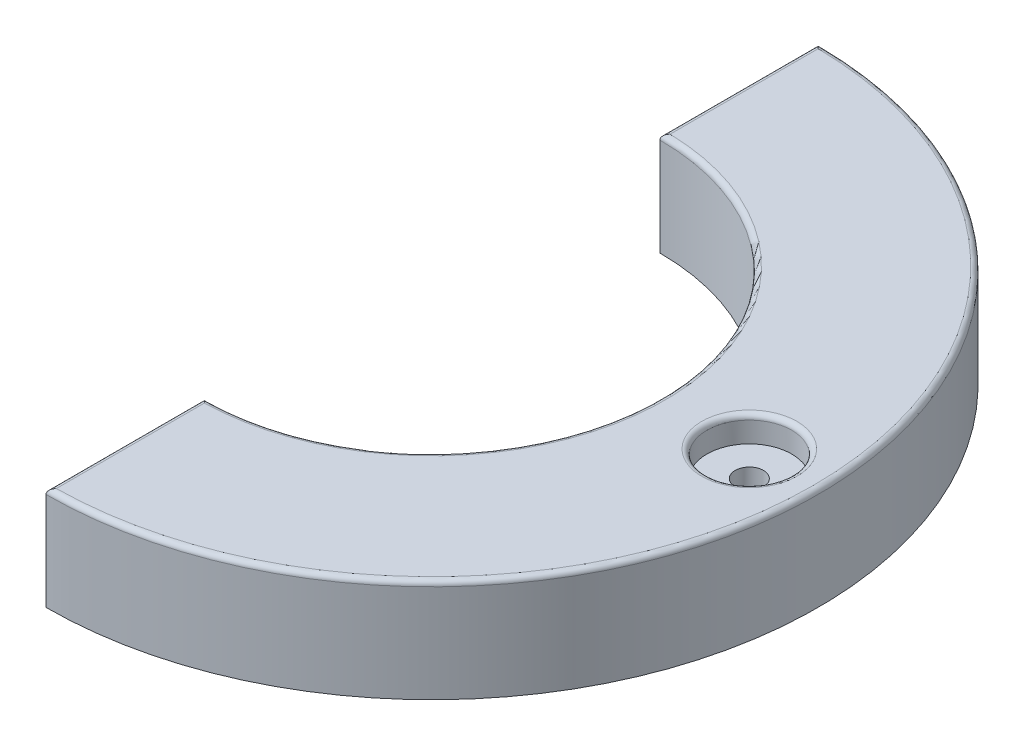
from build123d import *

# Parameters (mm, degrees)
BOSS_EXTRUDE1_DEPTH = 20
SKETCH3_R           = 2.1
CUT_EXTRUDE2_DEPTH  = 30
SKETCH4_R           = 8.25
CUT_EXTRUDE3_DEPTH  = 5
FILLET1_R           = 1
FILLET2_R           = 1
FILLET3_R           = 1
SKETCH5_R           = 2.75
CUT_EXTRUDE4_DEPTH  = 20
SKETCH6_R           = 5
CUT_EXTRUDE5_DEPTH  = 4


with BuildPart() as part:
    # Sketch1 → Boss-Extrude1 (new body)
    with BuildSketch(Plane(origin=(0, 0, 0), x_dir=(1, 0, 0), z_dir=(0, 1, 0))):
        with BuildLine():
            Line((0, 44.25), (0, 75))
            ThreePointArc((0, 75), (75, 0), (0, -75))
            Line((0, -75), (0, -44.25))
            ThreePointArc((0, -44.25), (44.25, 0), (0, 44.25))
        make_face()
    extrude(amount=BOSS_EXTRUDE1_DEPTH)

    # Sketch3 → Cut-Extrude2 (cut)
    with BuildSketch(Plane.ZY):
        with Locations((-63, 10)):
            Circle(SKETCH3_R)
        with Locations((63, 10)):
            Circle(SKETCH3_R)
    extrude(amount=-CUT_EXTRUDE2_DEPTH, mode=Mode.SUBTRACT)

    # Sketch4 → Cut-Extrude3 (cut)
    with BuildSketch(Plane(origin=(0, 20, 0), x_dir=(1, 0, 0), z_dir=(0, 1, 0))):
        with Locations(Location((61.63, 0, 0), (0, 0, 270))):
            Circle(SKETCH4_R)
    extrude(amount=-CUT_EXTRUDE3_DEPTH, mode=Mode.SUBTRACT)

    # Fillet1
    fillet1_edges = [part.edges().sort_by_distance(p)[0] for p in [
        (61.63, 20, -8.25),
    ]]
    fillet(fillet1_edges, radius=FILLET1_R)

    # Fillet2
    fillet2_edges = [part.edges().sort_by_distance(p)[0] for p in [
        (44.25, 20, 0),
    ]]
    fillet(fillet2_edges, radius=FILLET2_R)

    # Fillet3
    # the kernel refuses this fillet: 1 mm, written as the material it takes off along each edge
    with BuildSketch(Plane(origin=(0, 20, -42.75), x_dir=(1, 0, 0), z_dir=(0, 0, -1)), Plane(origin=(0, 20, 77.5), x_dir=(1, 0, 0), z_dir=(0, 0, -1))) as fillet3_piece_1:
        with BuildLine():
            CenterArc((FILLET3_R, FILLET3_R), FILLET3_R, 180, 90)
            Line((0, FILLET3_R), (0, 0))
            Line((0, 0), (FILLET3_R, 0))
        make_face()
    extrude(amount=34.75, mode=Mode.SUBTRACT)
    with BuildSketch(Plane(origin=(0, 20, 0), x_dir=(-0.033380737313120155, 0, -0.9994427079009744), z_dir=(-0.9994427079009744, 0, 0.033380737313120155))) as fillet3_piece_2:
        with BuildLine():
            CenterArc((75 - FILLET3_R, FILLET3_R), FILLET3_R, 270, 90)
            Line((75, FILLET3_R), (75, 0))
            Line((75, 0), (75 - FILLET3_R, 0))
        make_face()
    revolve(axis=Axis((0, 20, 0), (0, -1, 0)), revolution_arc=183.825861464, mode=Mode.SUBTRACT)

    # Sketch5 → Cut-Extrude4 (cut)
    with BuildSketch(Plane(origin=(0, 15, 0), x_dir=(1, 0, 0), z_dir=(0, 1, 0))):
        with Locations(Location((61.63, 0, 0), (0, 0, 270))):
            Circle(SKETCH5_R)
    extrude(amount=-CUT_EXTRUDE4_DEPTH, mode=Mode.SUBTRACT)

    # Sketch6 → Cut-Extrude5 (cut)
    with BuildSketch(Plane.XZ):
        with Locations(Location((61.63, 0, 0), (0, 0, 270))):
            Circle(SKETCH6_R)
    extrude(amount=-CUT_EXTRUDE5_DEPTH, mode=Mode.SUBTRACT)


solid = part.part
